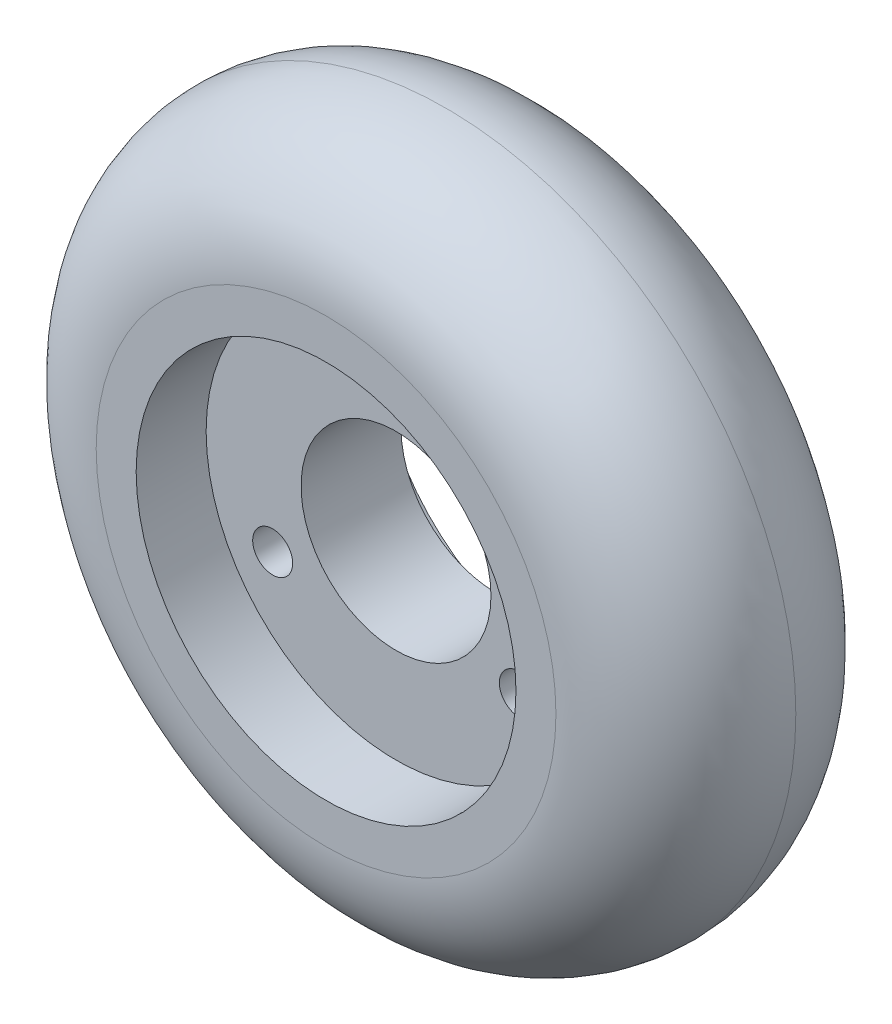
from build123d import *

# Parameters (mm, degrees)
ESQUISSE1_R             = 35
EXTRUSION1_DEPTH        = 24
CONG_1_R                = 12
CONG_2_R                = 12
ESQUISSE2_R             = 19
ENL_V_MAT_EXTRU_1_DEPTH = 7
ENL_V_START             = -7
ESQUISSE3_R             = 19
ENL_V_MAT_EXTRU_2_DEPTH = 7
ESQUISSE5_R             = 9.5
ESQUISSE5_R_2           = 2
ENL_V_MAT_EXTRU_3_DEPTH = 53.335456499


with BuildPart() as part:
    # Esquisse1 → Extrusion1 (new body)
    with BuildSketch(Plane.XY):
        Circle(ESQUISSE1_R)
    extrude(amount=EXTRUSION1_DEPTH)

    # Congé1
    cong_1_edges = [part.edges().sort_by_distance(p)[0] for p in [
        (-35, 0, 24),
    ]]
    fillet(cong_1_edges, radius=CONG_1_R)

    # Congé2
    cong_2_edges = [part.edges().sort_by_distance(p)[0] for p in [
        (-35, 0, 0),
    ]]
    fillet(cong_2_edges, radius=CONG_2_R - 0.0001)  # a hair under: the kernel refuses the full size

    # Esquisse2 → Enlèv. mat.-Extru.1 (cut)
    with BuildSketch(Plane.XY.offset(24)):
        Circle(ESQUISSE2_R)
    extrude(amount=-ENL_V_MAT_EXTRU_1_DEPTH, mode=Mode.SUBTRACT)

    # Esquisse3 → Enlèv. mat.-Extru.2 (cut)
    with BuildSketch(Plane(origin=(0, 0, 0), x_dir=(-1, 0, 0), z_dir=(0, 0, -1)).offset(ENL_V_START)):
        with Locations(Location((0, 0, 0), (0, 0, 180))):
            Circle(ESQUISSE3_R)
    extrude(amount=ENL_V_MAT_EXTRU_2_DEPTH, mode=Mode.SUBTRACT)

    # Esquisse5 → Enlèv. mat.-Extru.3 (cut, through all)
    with BuildSketch(Plane.XY.offset(17)):
        Circle(ESQUISSE5_R)
        with Locations((0, 14.25)):
            Circle(ESQUISSE5_R_2)
        with Locations((12.340862004, -7.125)):
            Circle(ESQUISSE5_R_2)
        with Locations((-12.340862004, -7.125)):
            Circle(ESQUISSE5_R_2)
    extrude(amount=-ENL_V_MAT_EXTRU_3_DEPTH, mode=Mode.SUBTRACT)


solid = part.part
